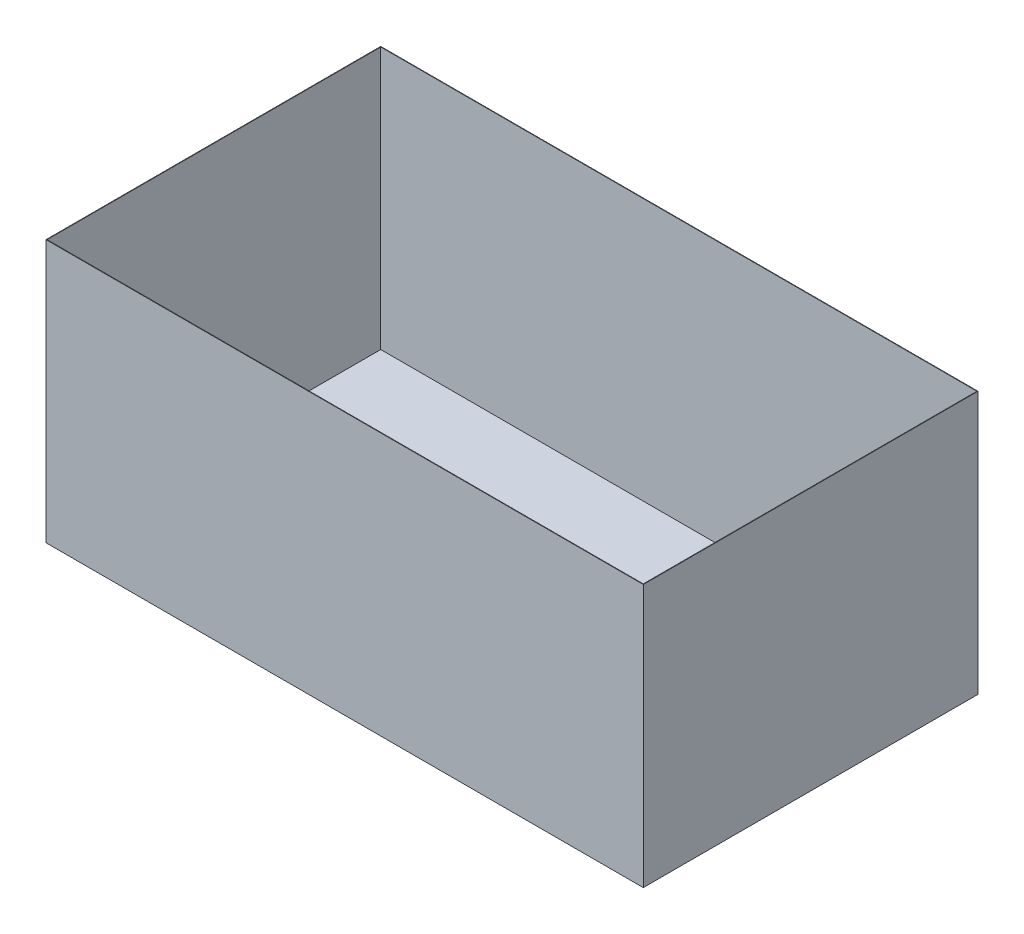
from build123d import *

# Parameters (mm, degrees)
SKETCH1_W           = 1295.4
SKETCH1_H           = 1016
BOSS_EXTRUDE1_DEPTH = 2311.4
SKETCH2_W           = 2307.39999784
SKETCH2_H           = 1291.39999784
CUT_EXTRUDE1_DEPTH  = 1013.99999892


with BuildPart() as part:
    # Sketch1 → Boss-Extrude1 (new body)
    with BuildSketch(Plane(origin=(0, 0, 0), x_dir=(0, 0, -1), z_dir=(1, 0, 0))):
        with Locations((647.7, 508)):
            Rectangle(SKETCH1_W, SKETCH1_H)
    extrude(amount=-BOSS_EXTRUDE1_DEPTH)

    # Sketch2 → Cut-Extrude1 (cut)
    with BuildSketch(Plane(origin=(0, 1016, 0), x_dir=(1, 0, 0), z_dir=(0, 1, 0))):
        with Locations((-1155.7, 647.7)):
            Rectangle(SKETCH2_W, SKETCH2_H)
    extrude(amount=-CUT_EXTRUDE1_DEPTH, mode=Mode.SUBTRACT)


solid = part.part
